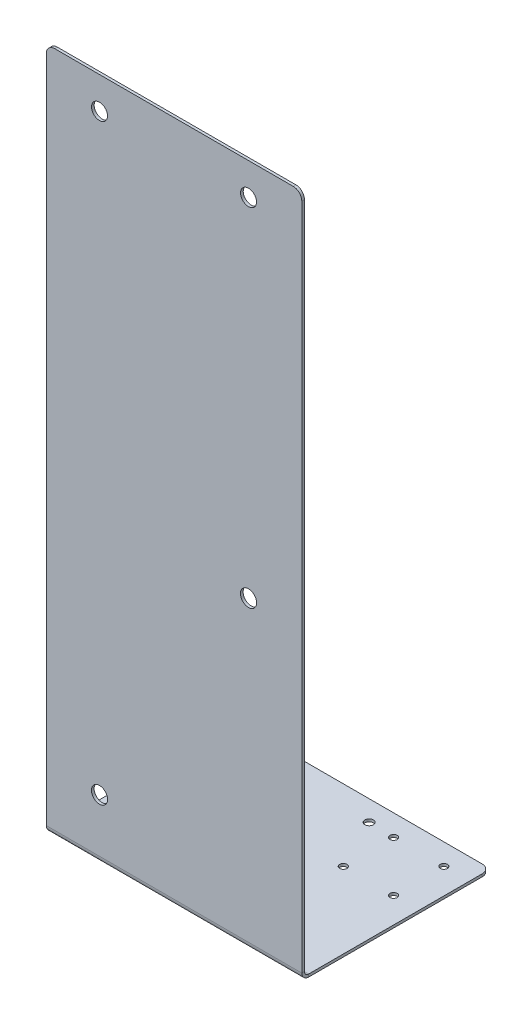
from build123d import *

# Parameters (mm, degrees)
SKETCH1_W            = 152.4
SKETCH1_H            = 114.3
BOSS_EXTRUDE1_DEPTH  = 3.175
SKETCH2_W            = 152.4
SKETCH2_H            = 3.175
BOSS_EXTRUDE2_DEPTH  = 406.4
FILLET1_R            = 2.54
FILLET2_R            = 5.08
SKETCH3_R            = 30.988
SKETCH3_R_2          = 2.54
SKETCH3_R_3          = 2.159
SKETCH3_R_4          = 2.15
CUT_EXTRUDE1_DEPTH   = 418.41289211
CONVERT_SOLID1_START = -76.2
CONVERT_SOLID1_DEPTH = 152.4
SKETCH4_R            = 4.7625
SKETCH4_R_2          = 4.826
CUT_EXTRUDE2_DEPTH   = 432.169208374


# Read off the part's stored shape, not the designer's step: Convert-Solid1
with BuildPart() as part:
    # Sketch1 → Boss-Extrude1 (new body)
    with BuildSketch(Plane(origin=(0, 0, 0), x_dir=(1, 0, 0), z_dir=(0, 1, 0))):
        Rectangle(SKETCH1_W, SKETCH1_H)
    extrude(amount=BOSS_EXTRUDE1_DEPTH)

    # Sketch2 → Boss-Extrude2 (add)
    with BuildSketch(Plane(origin=(0, 3.175, 0), x_dir=(1, 0, 0), z_dir=(0, 1, 0))):
        with Locations((0, -55.5625)):
            Rectangle(SKETCH2_W, SKETCH2_H)
    extrude(amount=BOSS_EXTRUDE2_DEPTH)

    # Fillet1
    fillet1_edges = [part.edges().sort_by_distance(p)[0] for p in [
        (0, 3.175, 53.975),
        (0, 0, 57.15),
    ]]
    fillet(fillet1_edges, radius=FILLET1_R)

    # Fillet2
    fillet2_edges = [part.edges().sort_by_distance(p)[0] for p in [
        (-76.2, 409.575, 55.5625),
        (76.2, 409.575, 55.5625),
        (-76.2, 1.5875, -57.15),
        (76.2, 1.5875, -57.15),
    ]]
    fillet(fillet2_edges, radius=FILLET2_R)

    # Sketch3 → Cut-Extrude1 (cut, through all)
    with BuildSketch(Plane(origin=(0, 3.175, 0), x_dir=(1, 0, 0), z_dir=(0, 1, 0))):
        with Locations(Location((-25.4, 3.81, 0), (0, 0, 270))):
            Circle(SKETCH3_R)
        with Locations(Location((15.875, 44.958, 0), (0, 0, 270))):
            Circle(SKETCH3_R_2)
        with Locations(Location((-66.675, -37.465, 0), (0, 0, 270))):
            Circle(SKETCH3_R_2)
        with Locations(Location((15.875, -37.465, 0), (0, 0, 270))):
            Circle(SKETCH3_R_2)
        with Locations(Location((30.988, 44.45, 0), (0, 0, 270))):
            Circle(SKETCH3_R_3)
        with Locations(Location((60.93860251, 44.46, 0), (0, 0, 270))):
            Circle(SKETCH3_R_4)
        with Locations(Location((60.96, 14.478, 0), (0, 0, 270))):
            Circle(SKETCH3_R_3)
        with Locations(Location((30.93860251, 14.478, 0), (0, 0, 270))):
            Circle(SKETCH3_R_3)
        with Locations(Location((-66.675, 45.085, 0), (0, 0, 270))):
            Circle(SKETCH3_R_2)
    extrude(amount=-CUT_EXTRUDE1_DEPTH, mode=Mode.SUBTRACT)

    # Convert-Solid1 outline → Convert-Solid1 (cut)
    with BuildSketch(Plane.YZ.offset(CONVERT_SOLID1_START)):
        with BuildLine():
            Line((1.5875, -57.15), (1.5875, 51.435))
            ThreePointArc((1.5875, 51.435), (2.796416761, 54.353583239), (5.715, 55.5625))
            Line((5.715, 55.5625), (409.575, 55.5625))
            Line((409.575, 55.5625), (409.575, 57.15))
            Line((409.575, 57.15), (2.54, 57.15))
            ThreePointArc((2.54, 57.15), (0.743948776, 56.406051224), (0, 54.61))
            Line((0, 54.61), (0, -57.15))
            Line((0, -57.15), (1.5875, -57.15))
        make_face()
    extrude(amount=CONVERT_SOLID1_DEPTH, mode=Mode.SUBTRACT)

    # Sketch4 → Cut-Extrude2 (cut, through all)
    with BuildSketch(Plane(origin=(0, 0, 53.975), x_dir=(-1, 0, 0), z_dir=(0, 0, -1))):
        with Locations((-44.45, 390.525)):
            Circle(SKETCH4_R)
        with Locations((44.45, 390.525)):
            Circle(SKETCH4_R)
        with Locations((-44.45, 183.515)):
            Circle(SKETCH4_R_2)
        with Locations((44.45, 37.465)):
            Circle(SKETCH4_R_2)
    extrude(amount=-CUT_EXTRUDE2_DEPTH, mode=Mode.SUBTRACT)


solid = part.part
